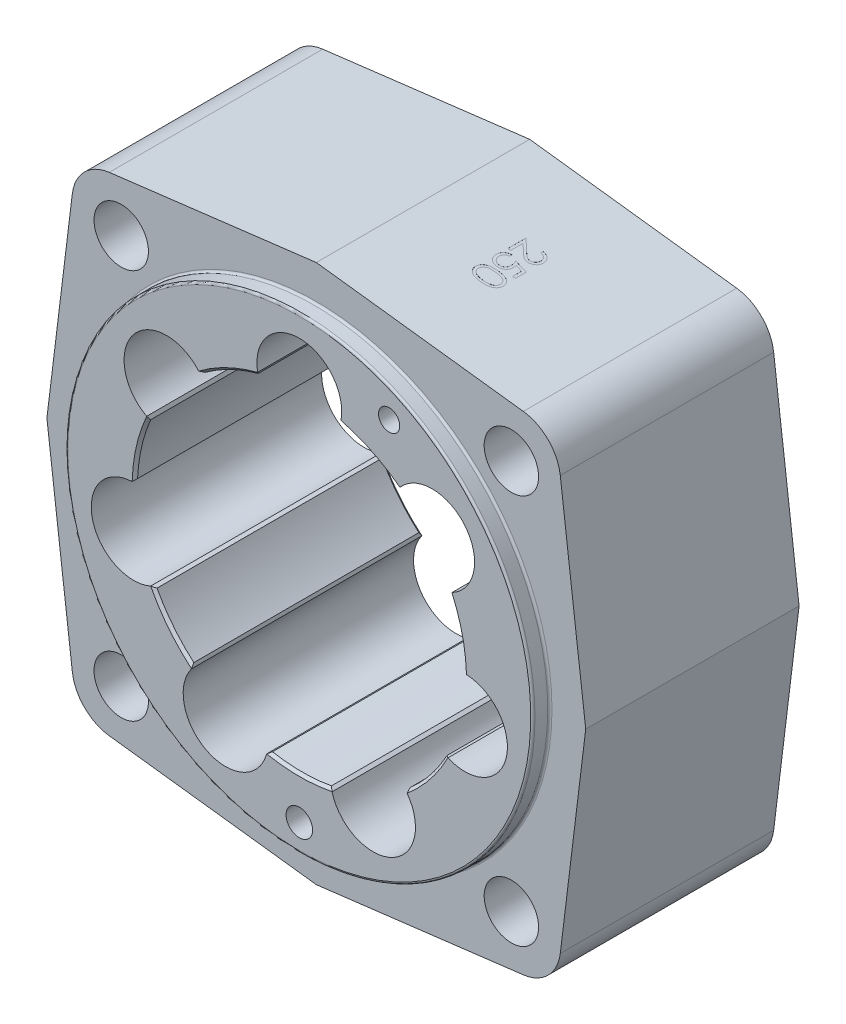
from build123d import *

# Parameters (mm, degrees)
SKETCH1_R                        = 31
EXTRUDE1_DEPTH                   = 21.7
CHAMFER1_SIZE                    = 0.5
F_12_8_12_8_DIAMETER_HOLE1_D     = 10.25
F_12_8_12_8_DIAMETER_HOLE1_DEPTH = 316
F_12_8_12_8_DIAMETER_HOLE1_TIP   = 3.079410673
SKETCH7_R                        = 71.34
SKETCH7_R_2                      = 44
O_RING_CUT_DEPTH                 = 3.2
EXTRUDE3_REACH                   = 85.873
SKETCH5_R                        = 7.99
CIRPATTERN1_COUNT                = 7
PIN_HOLE_REACH                   = 85.873
SKETCH6_R                        = 2.5
FILLET1_R                        = 0.4
CUT_EXTRUDE1_DEPTH               = 0.01
F_4_0_4_DIAMETER_HOLE1_D         = 4
F_4_0_4_DIAMETER_HOLE1_DEPTH     = 6
F_4_0_4_DIAMETER_HOLE1_TIP       = 1.201721238


with BuildPart() as part:
    # Sketch1 → Extrude1 (new, symmetric)
    with BuildSketch(Plane.XY):
        with BuildLine():
            Line((0, 50.75), (-38.996426437, 45.961840903))
            ThreePointArc((-38.996426437, 45.961840903), (-43.678325939, 43.678325939), (-45.961840903, 38.996426437))
            Line((-45.961840903, 38.996426437), (-50.75, 0))
            Line((-50.75, 0), (-45.961840903, -38.996426437))
            ThreePointArc((-45.961840903, -38.996426437), (-43.678325939, -43.678325939), (-38.996426437, -45.961840903))
            Line((-38.996426437, -45.961840903), (0, -50.75))
            Line((0, -50.75), (38.996426437, -45.961840903))
            ThreePointArc((38.996426437, -45.961840903), (43.678325939, -43.678325939), (45.961840903, -38.996426437))
            Line((45.961840903, -38.996426437), (50.75, 0))
            Line((50.75, 0), (45.961840903, 38.996426437))
            ThreePointArc((45.961840903, 38.996426437), (43.678325939, 43.678325939), (38.996426437, 45.961840903))
            Line((38.996426437, 45.961840903), (0, 50.75))
        make_face()
        Circle(SKETCH1_R, mode=Mode.SUBTRACT)
    extrude(amount=EXTRUDE1_DEPTH, both=True)

    # Chamfer1
    chamfer1_edges = [part.edges().sort_by_distance(p)[0] for p in [
        (-31, 0, -21.7),
        (-31, 0, 21.7),
    ]]
    chamfer(chamfer1_edges, length=CHAMFER1_SIZE)

    # Ø12.8 (12.8) Diameter Hole1
    with Locations(Plane.XY.offset(21.7)):
        with Locations((-36.75, 36.75), (36.75, 36.75), (36.75, -36.75), (-36.75, -36.75)):
            Hole(F_12_8_12_8_DIAMETER_HOLE1_D / 2, depth=F_12_8_12_8_DIAMETER_HOLE1_DEPTH)
            with Locations((0, 0, -(F_12_8_12_8_DIAMETER_HOLE1_DEPTH + F_12_8_12_8_DIAMETER_HOLE1_TIP / 2))):  # 118° drill point
                Cone(0, F_12_8_12_8_DIAMETER_HOLE1_D / 2, F_12_8_12_8_DIAMETER_HOLE1_TIP, mode=Mode.SUBTRACT)

    # Sketch7 → O-RING CUT (cut)
    with BuildSketch(Plane.XY.offset(21.7)):
        Circle(SKETCH7_R)
        Circle(SKETCH7_R_2, mode=Mode.SUBTRACT)
    extrude(amount=-O_RING_CUT_DEPTH, mode=Mode.SUBTRACT)

    # Sketch5 → Extrude3 (cut, up to next)
    with BuildSketch(Plane.XY.offset(21.7), mode=Mode.PRIVATE) as extrude3_sk1:
        with Locations((0, 32.01)):
            Circle(SKETCH5_R)
    extrude3_tool1 = extrude(extrude3_sk1.sketch, amount=-EXTRUDE3_REACH, mode=Mode.PRIVATE) & part.part
    extrude3 = extrude3_tool1.solids().sort_by_distance((0, 32.01, 21.7))[0]
    add(extrude3, mode=Mode.SUBTRACT)

    # CirPattern1: Extrude3 ×7 about axis
    cirpattern1_axis = Axis((0, 0, 0), (0, 0, 1))
    for i in range(1, CIRPATTERN1_COUNT):
        add(extrude3.rotate(cirpattern1_axis, i * 360 / CIRPATTERN1_COUNT), mode=Mode.SUBTRACT)

    # Sketch6 → PIN HOLE (cut, up to next)
    with BuildSketch(Plane.XY.offset(21.7), mode=Mode.PRIVATE) as pin_hole_sk1:
        with Locations((0, -39)):
            Circle(SKETCH6_R)
    pin_hole_tool1 = extrude(pin_hole_sk1.sketch, amount=-PIN_HOLE_REACH, mode=Mode.PRIVATE) & part.part
    add(pin_hole_tool1.solids().sort_by_distance((0, -39, 21.7))[0], mode=Mode.SUBTRACT)

    # Fillet1
    fillet1_edges = [part.edges().sort_by_distance(p)[0] for p in [
        (-44, 0, 18.5),
        (-44, 0, 21.7),
    ]]
    fillet(fillet1_edges, radius=FILLET1_R)

    # Chamfer2
    # the kernel refuses this chamfer: 0.500201988, 0.5 mm, written as the material it takes off along each edge
    with BuildSketch(Plane(origin=(-27.544268203, -14.223687608, -22.529427842), x_dir=(-0.9030774833281986, -0.42947765844756963, 0), z_dir=(0, 0, 1)), Plane(origin=(-28.294097093, 12.666651874, -22.529427842), x_dir=(-0.898838755534347, 0.43827946740574814, 0), z_dir=(0, 0, 1)), Plane(origin=(-7.737893777, 30.018744142, -22.529427842), x_dir=(-0.21775611185392035, 0.9760032150307, 0), z_dir=(0, 0, 1)), Plane(origin=(18.645101377, 24.766109801, -22.529427842), x_dir=(0.6273013254676859, 0.7787766349002031, 0), z_dir=(0, 0, 1)), Plane(origin=(30.987954903, 0.864089642, -22.529427842), x_dir=(0.9999880700970578, -0.004884635458422905, 0), z_dir=(0, 0, 1)), Plane(origin=(19.996246349, -23.688607641, -22.529427842), x_dir=(0.6196634019041385, -0.7848676756884502, 0), z_dir=(0, 0, 1)), Plane(origin=(-6.053043556, -30.403300211, -22.529427842), x_dir=(-0.22728044675241438, -0.9738293477422125, 0), z_dir=(0, 0, 1))) as chamfer2_piece_1:
        with BuildLine():
            Line((0.516996912, 0), (-0.020619338, 0.503902605))
            ThreePointArc((-0.020619338, 0.503902605), (-0.009577506, 0.259123147), (0, 0))
            ThreePointArc((0, 0), (0.26580762, 0.004179319), (0.516996912, 0))
        make_face()
    extrude(amount=45.058855684, mode=Mode.SUBTRACT)
    with BuildSketch(Plane(origin=(-30.987954903, 0.864089642, -22.529427842), x_dir=(-0.9999880700970578, -0.004884635458422838, 0), z_dir=(0, 0, 1)), Plane(origin=(-18.645101377, 24.766109801, -22.529427842), x_dir=(-0.6273013254676867, 0.7787766349002024, 0), z_dir=(0, 0, 1)), Plane(origin=(7.737893777, 30.018744142, -22.529427842), x_dir=(0.21775611185392052, 0.9760032150307, 0), z_dir=(0, 0, 1)), Plane(origin=(28.294097093, 12.666651874, -22.529427842), x_dir=(0.8988387555343457, 0.4382794674057509, 0), z_dir=(0, 0, 1)), Plane(origin=(27.544268203, -14.223687608, -22.529427842), x_dir=(0.9030774833281973, -0.42947765844757246, 0), z_dir=(0, 0, 1)), Plane(origin=(6.053043556, -30.403300211, -22.529427842), x_dir=(0.22728044675241613, -0.973829347742212, 0), z_dir=(0, 0, 1)), Plane(origin=(-19.996246349, -23.688607641, -22.529427842), x_dir=(-0.6196634019041427, -0.7848676756884467, 0), z_dir=(0, 0, 1))) as chamfer2_piece_2:
        with BuildLine():
            Line((0.516996912, 0), (-0.020619338, -0.503902605))
            ThreePointArc((-0.020619338, -0.503902605), (-0.009577506, -0.259123147), (0, 0))
            ThreePointArc((0, 0), (0.26580762, -0.004179319), (0.516996912, 0))
        make_face()
    extrude(amount=45.058855684, mode=Mode.SUBTRACT)

    # Sketch8 → Cut-Extrude1 (cut)
    # profile 1 of 3: a face of its own
    with BuildSketch(Plane(origin=(6.138768101, 49.996254054, 0), x_dir=(0, 0, -1), z_dir=(-0.12186934340514312, -0.9925461516413226, 0))):
        with BuildLine():
            add(Edge.make_bspline(
                [(-0.715384615, 10.452017104), (-0.715853213, 10.53215623), (-0.71676347, 10.687827636), (-0.726889786, 10.914662839), (-0.743711703, 11.127463251), (-0.766765093, 11.32623906), (-0.79481935, 11.511041581), (-0.832270046, 11.681376948), (-0.874859764, 11.838033529), (-0.9242204, 11.98152217), (-0.979917242, 12.113776031), (-1.040537614, 12.237240604), (-1.108487321, 12.351729079), (-1.179882911, 12.45906878), (-1.257614441, 12.55750263), (-1.339469856, 12.648420719), (-1.428643965, 12.729721791), (-1.522105406, 12.803787937), (-1.620700355, 12.868715754), (-1.721618449, 12.92590538), (-1.825554315, 12.974762334), (-1.932791719, 13.013177242), (-2.042366802, 13.044907023), (-2.154662611, 13.06660552), (-2.26986456, 13.080258246), (-2.347623752, 13.081563486), (-2.387059295, 13.082225438)],
                knots=[0, 0, 0, 0, 1.646270934, 3.197905019, 4.663502075, 6.030701355, 7.308322542, 8.50163776, 9.611534131, 10.641858119, 11.616356847, 12.558055219, 13.465016945, 14.349605745, 15.204443733, 16.039544428, 16.859896111, 17.680448484, 18.487036065, 19.28249412, 20.06191084, 20.843045899, 21.620316918, 22.403196591, 23.190181807, 24, 24, 24, 24], degree=3))
            add(Edge.make_bspline(
                [(-2.387059295, 13.082225438), (-2.426824264, 13.081528559), (-2.505904277, 13.080142686), (-2.622819099, 13.066822768), (-2.73703293, 13.044721164), (-2.848058842, 13.013405486), (-2.956808823, 12.974554519), (-3.062432262, 12.925858638), (-3.165585236, 12.869174541), (-3.264628504, 12.802569002), (-3.360649383, 12.728308608), (-3.45128933, 12.644361938), (-3.536556596, 12.551576625), (-3.617521318, 12.450945391), (-3.691886456, 12.340538127), (-3.762705645, 12.222275113), (-3.826094268, 12.094088163), (-3.887143804, 11.958116066), (-3.939839499, 11.810596553), (-3.987362707, 11.652361181), (-4.025761233, 11.481540914), (-4.057745908, 11.299031992), (-4.082524331, 11.104164159), (-4.100570963, 10.897355137), (-4.110103941, 10.678468865), (-4.111899229, 10.528814794), (-4.112820513, 10.452017104)],
                knots=[0, 0, 0, 0, 0.810914788, 1.612654377, 2.396697861, 3.181598691, 3.963628158, 4.749916497, 5.551656086, 6.361998678, 7.18212741, 8.025565596, 8.878627764, 9.750805457, 10.657531673, 11.591944965, 12.560506719, 13.57287815, 14.630710178, 15.753379473, 16.941251878, 18.199788006, 19.531962791, 20.947069417, 22.433333509, 24, 24, 24, 24], degree=3))
            add(Edge.make_bspline(
                [(-4.112820513, 10.452017104), (-4.111889678, 10.375554379), (-4.110075984, 10.226569876), (-4.100677831, 10.008668483), (-4.082165501, 9.802956992), (-4.059008375, 9.608942046), (-4.02693557, 9.427431162), (-3.987499619, 9.257796235), (-3.943713443, 9.099304704), (-3.889663737, 8.953254974), (-3.83050558, 8.817609655), (-3.766141014, 8.6909423), (-3.697184119, 8.572133311), (-3.622057341, 8.462133672), (-3.541981036, 8.360164162), (-3.455241338, 8.268024701), (-3.364283359, 8.18349517), (-3.267979908, 8.108278559), (-3.167391978, 8.042443124), (-3.064593296, 7.983566195), (-2.957759892, 7.936090916), (-2.849312816, 7.895326572), (-2.737700865, 7.864183069), (-2.623063164, 7.84264899), (-2.505982827, 7.82754635), (-2.426837734, 7.826394235), (-2.387059295, 7.825815181)],
                knots=[0, 0, 0, 0, 1.561518951, 3.042555995, 4.452378317, 5.7783523, 7.031515105, 8.214008947, 9.334062868, 10.386615937, 11.391082383, 12.354592575, 13.286541444, 14.194233754, 15.072674879, 15.931287219, 16.775624067, 17.606195743, 18.42308326, 19.229000347, 20.022332153, 20.807536673, 21.593273796, 22.3848459, 23.188221202, 24, 24, 24, 24], degree=3))
            add(Edge.make_bspline(
                [(-2.387059295, 7.825815181), (-2.347624846, 7.826481403), (-2.269867811, 7.827795063), (-2.15465006, 7.841386108), (-2.042817998, 7.863236827), (-1.933819778, 7.893831976), (-1.827096185, 7.931281742), (-1.72410149, 7.980072718), (-1.623690513, 8.036264246), (-1.526131148, 8.100257705), (-1.433256632, 8.173574395), (-1.344544338, 8.254666236), (-1.262222883, 8.345556823), (-1.185602746, 8.444810999), (-1.11278262, 8.551515631), (-1.045797801, 8.667127593), (-0.983839438, 8.791188465), (-0.92720588, 8.924499766), (-0.876993504, 9.069006806), (-0.832639635, 9.226362775), (-0.79761941, 9.397956541), (-0.767643759, 9.582409922), (-0.743466069, 9.780515537), (-0.72695989, 9.992380935), (-0.716758012, 10.21787409), (-0.715850768, 10.372545196), (-0.715384615, 10.452017104)],
                knots=[0, 0, 0, 0, 0.810891512, 1.598919785, 2.382837074, 3.152667961, 3.926044502, 4.706494248, 5.493654104, 6.291793342, 7.103789334, 7.925228297, 8.761435821, 9.622817696, 10.50288917, 11.416980706, 12.369136599, 13.353924996, 14.394355917, 15.514179734, 16.714354668, 17.994756427, 19.357759367, 20.818452758, 22.365282078, 24, 24, 24, 24], degree=3))
        make_face()
        with BuildLine():
            add(Edge.make_bspline(
                [(-1.164102564, 10.454020309), (-1.164273203, 10.387236454), (-1.164604379, 10.257622104), (-1.173256094, 10.069274589), (-1.18504214, 9.89360269), (-1.200243993, 9.730383352), (-1.222819634, 9.580169049), (-1.248115045, 9.441926644), (-1.27889803, 9.316387734), (-1.315319484, 9.202690862), (-1.356803908, 9.098906478), (-1.402097999, 9.002333314), (-1.450756175, 8.911830548), (-1.505212104, 8.828211107), (-1.564519337, 8.751202301), (-1.627338279, 8.679441112), (-1.696013399, 8.615445425), (-1.791018746, 8.538692774), (-1.916442281, 8.459379726), (-2.074471502, 8.390313884), (-2.236855004, 8.346910374), (-2.347071075, 8.341390723), (-2.402083333, 8.338635694)],
                knots=[0, 0, 0, 0, 1.459021318, 2.831673884, 4.118529203, 5.306027144, 6.411944654, 7.436330062, 8.375795394, 9.233974572, 10.042671642, 10.816086306, 11.563610507, 12.285937304, 12.993564865, 13.685989202, 14.367179055, 15.041617293, 16.353048772, 17.594441528, 18.799311195, 20, 20, 20, 20], degree=3))
            add(Edge.make_bspline(
                [(-2.402083333, 8.338635694), (-2.457451436, 8.340918238), (-2.568073326, 8.345478613), (-2.729693033, 8.38947681), (-2.886593419, 8.455861866), (-3.009553334, 8.534358302), (-3.103099825, 8.609113059), (-3.170124096, 8.672848271), (-3.231641308, 8.744213795), (-3.289987129, 8.82121279), (-3.343500095, 8.905316338), (-3.39216172, 8.996120017), (-3.436566502, 9.093875986), (-3.461865139, 9.16211847), (-3.474799679, 9.197009091)],
                knots=[0, 0, 0, 0, 1.353760809, 2.704726607, 4.075137775, 5.516104923, 6.260822281, 7.007110065, 7.778089737, 8.566572457, 9.372053459, 10.217411131, 11.088608312, 12, 12, 12, 12], degree=3))
            add(Edge.make_bspline(
                [(-3.474799679, 9.197009091), (-3.489873633, 9.241623005), (-3.520480225, 9.332208382), (-3.559925616, 9.472727885), (-3.590990472, 9.620160405), (-3.618938138, 9.773624858), (-3.638013932, 9.934253002), (-3.653367951, 10.101547836), (-3.662411789, 10.275635497), (-3.663532862, 10.393914055), (-3.664102564, 10.454020309)],
                knots=[0, 0, 0, 0, 0.884706709, 1.796334032, 2.740027952, 3.714592787, 4.726048262, 5.777819803, 6.87074269, 8, 8, 8, 8], degree=3))
            add(Edge.make_bspline(
                [(-3.664102564, 10.454020309), (-3.663316579, 10.514116842), (-3.661779026, 10.631678506), (-3.6559019, 10.803847335), (-3.640725365, 10.967372708), (-3.623869481, 11.122959097), (-3.599016308, 11.269745244), (-3.572219441, 11.408959966), (-3.536217709, 11.538878573), (-3.497760888, 11.661535118), (-3.453746037, 11.775536053), (-3.405294988, 11.881412891), (-3.353549619, 11.979676783), (-3.297346418, 12.070058128), (-3.237352585, 12.152961761), (-3.171984658, 12.226725468), (-3.103835554, 12.293635422), (-3.008382431, 12.370010521), (-2.88341916, 12.447884371), (-2.727925378, 12.519549743), (-2.566110172, 12.560704446), (-2.456719523, 12.566506856), (-2.402083333, 12.569404925)],
                knots=[0, 0, 0, 0, 1.31362396, 2.569729283, 3.763502607, 4.902122613, 5.988968491, 7.01645872, 7.998833611, 8.933434873, 9.825090667, 10.667526885, 11.477055099, 12.250526234, 12.991942729, 13.710640831, 14.402115721, 15.076753259, 16.378508321, 17.609869233, 18.806226677, 20, 20, 20, 20], degree=3))
            add(Edge.make_bspline(
                [(-2.402083333, 12.569404925), (-2.346782487, 12.566502858), (-2.236080051, 12.560693438), (-2.072582973, 12.519703076), (-1.91586247, 12.448255982), (-1.791229649, 12.369752592), (-1.695709954, 12.294983576), (-1.628448964, 12.230145784), (-1.565383004, 12.159222564), (-1.507286289, 12.081505543), (-1.452873027, 11.997983589), (-1.402900152, 11.90799964), (-1.357875396, 11.811097691), (-1.316326058, 11.707359926), (-1.279793504, 11.593672863), (-1.249659271, 11.468288586), (-1.221820623, 11.330485883), (-1.202113096, 11.179458015), (-1.184593445, 11.016197796), (-1.173334377, 10.840087341), (-1.164575438, 10.651423941), (-1.164263346, 10.521139428), (-1.164102564, 10.454020309)],
                knots=[0, 0, 0, 0, 1.207732386, 2.417664972, 3.655092373, 4.956220595, 5.625982001, 6.301752483, 6.994047911, 7.697131622, 8.419323945, 9.170223765, 9.943494443, 10.752040957, 11.610060368, 12.549350801, 13.567764191, 14.679664412, 15.874934091, 17.154273443, 18.533957287, 20, 20, 20, 20], degree=3))
        make_face(mode=Mode.SUBTRACT)
    # profile 2 of 3: a face of its own
    with BuildSketch(Plane(origin=(6.138768101, 49.996254054, 0), x_dir=(0, 0, -1), z_dir=(-0.12186934340514312, -0.9925461516413226, 0))):
        with BuildLine():
            Line((-0.01025641, 12.954020309), (-0.01025641, 12.441199797))
            Line((-0.01025641, 12.441199797), (1.690464744, 12.441199797))
            Line((1.690464744, 12.441199797), (1.959895833, 11.12609563))
            add(Edge.make_bspline(
                [(1.959895833, 11.12609563), (1.90695887, 11.140710304), (1.804401876, 11.169023923), (1.653030646, 11.200460738), (1.509327498, 11.219411373), (1.416076969, 11.221998959), (1.370953526, 11.223251079)],
                knots=[0, 0, 0, 0, 1.100273476, 2.13160584, 3.095893838, 4, 4, 4, 4], degree=3))
            add(Edge.make_bspline(
                [(1.370953526, 11.223251079), (1.315119612, 11.222042599), (1.205336187, 11.219666426), (1.04470912, 11.196849499), (0.891376415, 11.160935335), (0.745658744, 11.110763161), (0.607286528, 11.046606399), (0.477532869, 10.966463627), (0.354450136, 10.872844583), (0.240246431, 10.765208851), (0.136640276, 10.646749399), (0.045546005, 10.519381012), (-0.031829124, 10.384341494), (-0.094058774, 10.240340625), (-0.14375068, 10.088970406), (-0.176824958, 9.928638145), (-0.198848828, 9.760855116), (-0.20130938, 9.646134302), (-0.202564103, 9.587634091)],
                knots=[0, 0, 0, 0, 1.052922333, 2.070308379, 3.05430497, 4.020497103, 4.973039431, 5.925935799, 6.892292201, 7.88610001, 8.88166317, 9.857072816, 10.836096531, 11.812156883, 12.81219415, 13.836441305, 14.89672472, 16, 16, 16, 16], degree=3))
            add(Edge.make_bspline(
                [(-0.202564103, 9.587634091), (-0.201613995, 9.546888062), (-0.19972662, 9.465946652), (-0.190128637, 9.345740651), (-0.171649043, 9.22807946), (-0.146838009, 9.112947472), (-0.114634554, 9.000562655), (-0.075650192, 8.890603329), (-0.027941581, 8.783753891), (0.024388955, 8.679003327), (0.083312495, 8.578719745), (0.148710363, 8.484935478), (0.217803922, 8.396243648), (0.292148758, 8.313595458), (0.372435894, 8.237534004), (0.457692989, 8.167607887), (0.547239731, 8.102634558), (0.642461506, 8.045251422), (0.741236481, 7.992447199), (0.844991077, 7.94912786), (0.951363506, 7.910398534), (1.061884757, 7.87952778), (1.17630449, 7.855338417), (1.294811312, 7.838908987), (1.416783697, 7.826942648), (1.499462287, 7.826193567), (1.541225962, 7.825815181)],
                knots=[0, 0, 0, 0, 1.056347294, 2.098418968, 3.122841568, 4.141288669, 5.149314143, 6.15115421, 7.162517403, 8.180376062, 9.185164535, 10.17417709, 11.141909838, 12.097768115, 13.052685741, 14.0056014, 14.954263652, 15.917497458, 16.885230207, 17.854509472, 18.828990115, 19.81800267, 20.826176721, 21.857883937, 22.917946725, 24, 24, 24, 24], degree=3))
            add(Edge.make_bspline(
                [(1.541225962, 7.825815181), (1.59104622, 7.826802093), (1.689061692, 7.828743724), (1.832662502, 7.849055846), (1.970826225, 7.878147155), (2.102440655, 7.921913255), (2.228685317, 7.976752247), (2.347860628, 8.046061064), (2.463011737, 8.124602641), (2.569457504, 8.217288859), (2.668251952, 8.318596976), (2.756689821, 8.428536464), (2.835452074, 8.545292809), (2.903277427, 8.66943303), (2.961131743, 8.800630931), (3.006581726, 8.939378075), (3.04326509, 9.084949509), (3.058784263, 9.18516881), (3.066666667, 9.236071591)],
                knots=[0, 0, 0, 0, 1.0467383, 2.05933395, 3.04377827, 4.011590433, 4.970194871, 5.932262533, 6.905835911, 7.896367577, 8.894135286, 9.877477877, 10.858688626, 11.851381753, 12.8477658, 13.868841284, 14.917554742, 16, 16, 16, 16], degree=3))
            Line((3.066666667, 9.236071591), (2.617948718, 9.236071591))
            add(Edge.make_bspline(
                [(2.617948718, 9.236071591), (2.606907922, 9.188390945), (2.585686898, 9.096746095), (2.539107257, 8.967987036), (2.482156006, 8.853245288), (2.414435509, 8.751003026), (2.333649751, 8.661847316), (2.241464852, 8.58239437), (2.138110962, 8.510715614), (2.023263491, 8.450968804), (1.902101949, 8.400013442), (1.775291649, 8.366082449), (1.64628544, 8.342224031), (1.559030626, 8.339835801), (1.515184295, 8.338635694)],
                knots=[0, 0, 0, 0, 1.136247022, 2.183929868, 3.172523383, 4.106158343, 5.02341133, 5.958108904, 6.928429099, 7.938127109, 8.96079061, 9.975095812, 10.982467395, 12, 12, 12, 12], degree=3))
            add(Edge.make_bspline(
                [(1.515184295, 8.338635694), (1.472386517, 8.339808234), (1.388117343, 8.342116974), (1.264101076, 8.359886992), (1.144368398, 8.387254951), (1.030100746, 8.428211886), (0.919298547, 8.477990056), (0.814764589, 8.541868735), (0.713474764, 8.615383047), (0.618577431, 8.699606805), (0.531663932, 8.792420654), (0.454869473, 8.891674073), (0.390902454, 8.997555283), (0.336996584, 9.108231215), (0.2960633, 9.224914868), (0.266861898, 9.347059404), (0.249714671, 9.474966519), (0.247355843, 9.56220839), (0.246153846, 9.60666454)],
                knots=[0, 0, 0, 0, 1.027316725, 2.022795036, 3.002884548, 3.971462791, 4.93288096, 5.914575861, 6.907176829, 7.935150275, 8.956128384, 9.956726525, 10.942570165, 11.921478529, 12.907843606, 13.90538589, 14.932640048, 16, 16, 16, 16], degree=3))
            add(Edge.make_bspline(
                [(0.246153846, 9.60666454), (0.247094531, 9.646772757), (0.248935788, 9.725278884), (0.26397946, 9.840134893), (0.290146563, 9.948810668), (0.326466392, 10.051831002), (0.372579974, 10.149293063), (0.428931849, 10.241297434), (0.49657956, 10.326631482), (0.573853687, 10.40533513), (0.658508031, 10.477970665), (0.751999092, 10.539890789), (0.852370416, 10.5919821), (0.958412701, 10.636936383), (1.07264827, 10.669223162), (1.192814888, 10.693462999), (1.320210185, 10.707484945), (1.407311168, 10.7094305), (1.452083333, 10.710430566)],
                knots=[0, 0, 0, 0, 1.045622112, 2.046656509, 3.013763289, 3.955457236, 4.890082067, 5.820317437, 6.762574623, 7.722996705, 8.69280354, 9.665887285, 10.63943826, 11.638615906, 12.663482002, 13.728887084, 14.832589034, 16, 16, 16, 16], degree=3))
            add(Edge.make_bspline(
                [(1.452083333, 10.710430566), (1.490838946, 10.70960115), (1.570859454, 10.707888616), (1.693606349, 10.695279335), (1.822594525, 10.674937486), (1.957329518, 10.646957132), (2.098215958, 10.610341309), (2.244956531, 10.566463451), (2.397859769, 10.514003452), (2.500885089, 10.474386004), (2.553846154, 10.454020309)],
                knots=[0, 0, 0, 0, 0.817624296, 1.688186739, 2.600797293, 3.572016777, 4.590301741, 5.671205678, 6.80286297, 8, 8, 8, 8], degree=3))
            Line((2.553846154, 10.454020309), (2.041025641, 12.954020309))
            Line((2.041025641, 12.954020309), (-0.01025641, 12.954020309))
        make_face()
    # profile 3 of 3: a face of its own
    with BuildSketch(Plane(origin=(6.138768101, 49.996254054, 0), x_dir=(0, 0, -1), z_dir=(-0.12186934340514312, -0.9925461516413226, 0))):
        with BuildLine():
            Line((6.335897436, 11.415558771), (6.784615385, 11.415558771))
            add(Edge.make_bspline(
                [(6.784615385, 11.415558771), (6.78169088, 11.475088611), (6.775947232, 11.592003631), (6.749049676, 11.762466355), (6.710562708, 11.925401782), (6.656146345, 12.079501659), (6.588565948, 12.226128526), (6.507523052, 12.364699977), (6.411531837, 12.49468739), (6.302665074, 12.614885737), (6.184424161, 12.725153695), (6.056844248, 12.820375471), (5.922779923, 12.900829287), (5.782637925, 12.968088204), (5.63483712, 13.018573698), (5.480718751, 13.056033183), (5.319605699, 13.07857082), (5.209834239, 13.080993371), (5.15400641, 13.082225438)],
                knots=[0, 0, 0, 0, 1.10065271, 2.161652631, 3.183658789, 4.190468796, 5.17591951, 6.163126047, 7.15150782, 8.156236427, 9.156009102, 10.134482811, 11.092018607, 12.041330605, 13.001268258, 13.972401359, 14.968799086, 16, 16, 16, 16], degree=3))
            add(Edge.make_bspline(
                [(5.15400641, 13.082225438), (5.09918059, 13.080941928), (4.991449812, 13.078419879), (4.834218363, 13.056761265), (4.684536514, 13.022838992), (4.542696847, 12.97524554), (4.409831041, 12.911267786), (4.284940977, 12.83441416), (4.166539819, 12.745528686), (4.059958699, 12.640880381), (3.962090015, 12.529162689), (3.877658222, 12.409894256), (3.805353702, 12.286709562), (3.745085588, 12.158669274), (3.700719675, 12.024567805), (3.667036521, 11.886357515), (3.647997359, 11.742607785), (3.645075325, 11.645312705), (3.643589744, 11.595847232)],
                knots=[0, 0, 0, 0, 1.111607364, 2.184268762, 3.212621178, 4.221274766, 5.211760367, 6.196651075, 7.1921475, 8.207485113, 9.220403448, 10.201281604, 11.166441695, 12.114753415, 13.065576456, 14.026450734, 14.996634279, 16, 16, 16, 16], degree=3))
            add(Edge.make_bspline(
                [(3.643589744, 11.595847232), (3.646008691, 11.526207469), (3.650804135, 11.388150021), (3.691824673, 11.185271645), (3.755891118, 10.988709618), (3.833030199, 10.830513472), (3.910847976, 10.703037053), (3.980972987, 10.59808176), (4.063065574, 10.485073948), (4.158320571, 10.364392037), (4.264767531, 10.235090744), (4.383370622, 10.097248179), (4.514975596, 9.952288508), (4.607344883, 9.853280506), (4.655208333, 9.80197704)],
                knots=[0, 0, 0, 0, 1.184426356, 2.348067706, 3.509069118, 4.696110526, 5.333549288, 6.050745305, 6.844228056, 7.710549037, 8.667450064, 9.695053472, 10.805634456, 12, 12, 12, 12], degree=3))
            Line((4.655208333, 9.80197704), (5.906209936, 8.466840822))
            Line((5.906209936, 8.466840822), (3.579487179, 8.466840822))
            Line((3.579487179, 8.466840822), (3.579487179, 7.954020309))
            Line((3.579487179, 7.954020309), (6.976923077, 7.954020309))
            Line((6.976923077, 7.954020309), (5.037820513, 10.023331207))
            add(Edge.make_bspline(
                [(5.037820513, 10.023331207), (4.990609246, 10.072614502), (4.899926064, 10.167277626), (4.77166524, 10.305481854), (4.656466686, 10.433695484), (4.553584696, 10.551676268), (4.465251117, 10.661149936), (4.386862214, 10.758570941), (4.324054227, 10.848220156), (4.255889376, 10.952135318), (4.189869403, 11.079010057), (4.133137465, 11.234058185), (4.098544825, 11.393668546), (4.09439506, 11.501528599), (4.092307692, 11.55578313)],
                knots=[0, 0, 0, 0, 1.329631726, 2.553950428, 3.673215718, 4.687767853, 5.603093632, 6.413772471, 7.123043292, 7.734684054, 8.834405432, 9.900288307, 10.943827018, 12, 12, 12, 12], degree=3))
            add(Edge.make_bspline(
                [(4.092307692, 11.55578313), (4.093215896, 11.589899413), (4.09500579, 11.657136057), (4.110802501, 11.755715712), (4.134674652, 11.850808304), (4.168882164, 11.942706331), (4.214034649, 12.030485834), (4.268996621, 12.114253663), (4.332410997, 12.195237899), (4.405769953, 12.271171182), (4.486357839, 12.340715761), (4.571492481, 12.402321597), (4.661564058, 12.453806041), (4.756192804, 12.496011037), (4.855114904, 12.529118725), (4.958521682, 12.552059552), (5.06612742, 12.566463101), (5.139603842, 12.568411918), (5.177043269, 12.569404925)],
                knots=[0, 0, 0, 0, 0.991446411, 1.95395049, 2.89581595, 3.838931463, 4.798493298, 5.75982156, 6.748411868, 7.785213223, 8.824556874, 9.840280684, 10.836137867, 11.835679398, 12.848801643, 13.863922112, 14.911575587, 16, 16, 16, 16], degree=3))
            add(Edge.make_bspline(
                [(5.177043269, 12.569404925), (5.216144459, 12.56838345), (5.292932739, 12.566377443), (5.405674215, 12.552345065), (5.513225326, 12.528136722), (5.615856616, 12.495027187), (5.713741738, 12.452943546), (5.806404658, 12.400526768), (5.893637357, 12.337978921), (5.975603819, 12.26706384), (6.051123789, 12.188110124), (6.117476469, 12.100095891), (6.175453632, 12.004628155), (6.226038251, 11.901964511), (6.267117808, 11.791173397), (6.298508023, 11.672648104), (6.323346376, 11.546903274), (6.331644262, 11.460067438), (6.335897436, 11.415558771)],
                knots=[0, 0, 0, 0, 1.031018746, 2.02475058, 2.990194455, 3.934040569, 4.864654155, 5.795059489, 6.735614925, 7.690564532, 8.649604399, 9.611025574, 10.590972636, 11.591080095, 12.624614302, 13.701020113, 14.821632451, 16, 16, 16, 16], degree=3))
        make_face()
    extrude(amount=CUT_EXTRUDE1_DEPTH, mode=Mode.SUBTRACT)

    # Ø4.0 (4) Diameter Hole1
    with Locations(Plane.XY.offset(21.7)):
        with Locations((16.921465826, 35.137785848)):
            Hole(F_4_0_4_DIAMETER_HOLE1_D / 2, depth=F_4_0_4_DIAMETER_HOLE1_DEPTH)
            with Locations((0, 0, -(F_4_0_4_DIAMETER_HOLE1_DEPTH + F_4_0_4_DIAMETER_HOLE1_TIP / 2))):  # 118° drill point
                Cone(0, F_4_0_4_DIAMETER_HOLE1_D / 2, F_4_0_4_DIAMETER_HOLE1_TIP, mode=Mode.SUBTRACT)


solid = part.part
